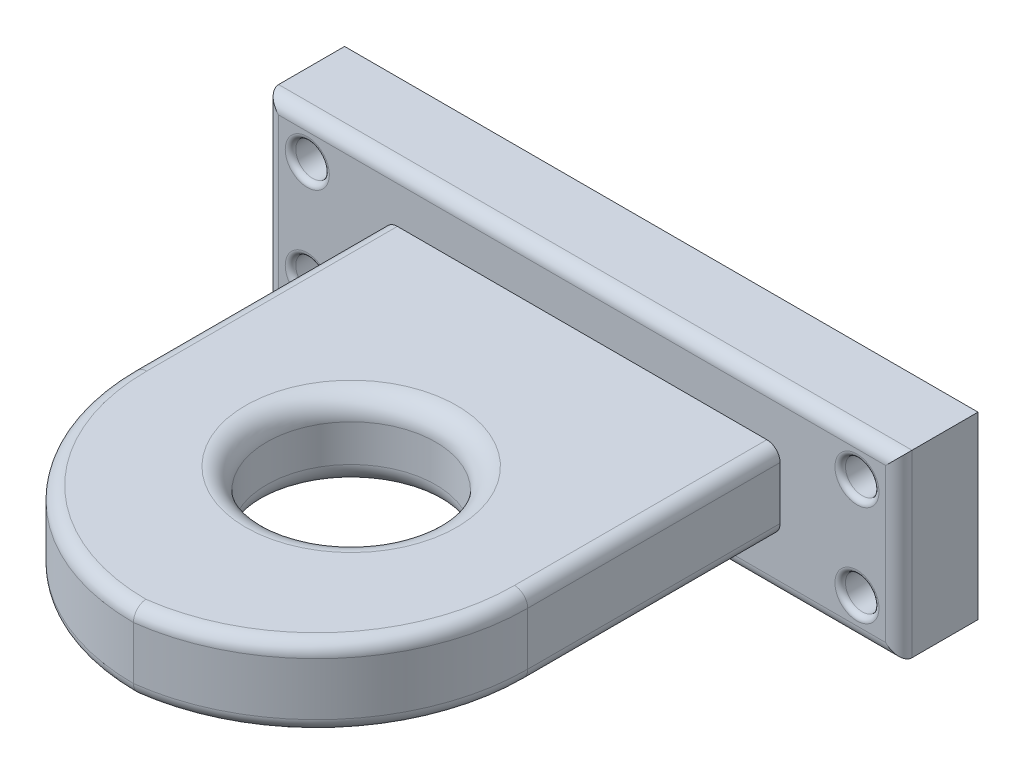
from build123d import *

# Parameters (mm, degrees)
SKETCH1_W           = 150
SKETCH1_H           = 175
BOSS_EXTRUDE1_DEPTH = 30
SKETCH3_R           = 32
CUT_EXTRUDE2_DEPTH  = 233.432785983
FILLET1_R           = 80
FILLET2_R           = 80
FILLET3_R           = 8
FILLET4_R           = 8
SKETCH5_W           = 240
SKETCH5_H           = 68.1
BOSS_EXTRUDE5_DEPTH = 30
FILLET5_R           = 5
FILLET6_R           = 5
SKETCH7_R           = 6.35
CUT_EXTRUDE3_DEPTH  = 267.563130487
FILLET7_R           = 2


with BuildPart() as part:
    # Sketch1 → Boss-Extrude1 (new body)
    with BuildSketch(Plane(origin=(0, 0, 0), x_dir=(1, 0, 0), z_dir=(0, 1, 0))):
        with Locations((75, -87.5)):
            Rectangle(SKETCH1_W, SKETCH1_H)
    extrude(amount=BOSS_EXTRUDE1_DEPTH)

    # Sketch3 → Cut-Extrude2 (cut, through all)
    with BuildSketch(Plane(origin=(0, 30, 0), x_dir=(-1, 0, 0), z_dir=(0, 1, 0))):
        with Locations(Location((-75, 87.5, 0), (0, 0, 90))):
            Circle(SKETCH3_R)
    extrude(amount=-CUT_EXTRUDE2_DEPTH, mode=Mode.SUBTRACT)

    # Fillet1
    fillet1_edges = [part.edges().sort_by_distance(p)[0] for p in [
        (0, 15, 175),
    ]]
    fillet(fillet1_edges, radius=FILLET1_R)

    # Fillet2
    # the kernel refuses this fillet: 80 mm, written as the material it takes off along each edge
    with BuildSketch(Plane(origin=(150, -198.43134833, 175), x_dir=(-1, 0, 0), z_dir=(0, 1, 0))) as fillet2_piece_1:
        with BuildLine():
            CenterArc((80, -79.372539332), FILLET2_R, 97.180755781, 82.819244219)
            Line((0, -79.372539332), (-1.6, -79.372539332))
            Line((-1.6, -79.372539332), (-1.6, 0))
            Line((-1.6, 0), (0, 1.6))
            ThreePointArc((0, 1.6), (35, 1.6), (69.8, 1.587450787))
            Line((69.8, 1.587450787), (70, 0))
        make_face()
    extrude(amount=426.86269666, mode=Mode.SUBTRACT)

    # Fillet3
    fillet3_edges = [part.edges().sort_by_distance(p)[0] for p in [
        (75, 30, 55.5),
    ]]
    fillet(fillet3_edges, radius=FILLET3_R)

    # Fillet4
    fillet4_edges = [part.edges().sort_by_distance(p)[0] for p in [
        (75, 0, 55.5),
    ]]
    fillet(fillet4_edges, radius=FILLET4_R)

    # Sketch5 → Boss-Extrude5 (add)
    with BuildSketch(Plane(origin=(0, 0, 0), x_dir=(-1, 0, 0), z_dir=(0, 0, -1))):
        with Locations((-75, 15)):
            Rectangle(SKETCH5_W, SKETCH5_H)
    extrude(amount=BOSS_EXTRUDE5_DEPTH)

    # Fillet5
    fillet5_edges = [part.edges().sort_by_distance(p)[0] for p in [
        (195, 15, 0),
        (75, -19.05, 0),
        (-45, 15, 0),
        (75, 49.05, 0),
    ]]
    fillet(fillet5_edges, radius=FILLET5_R)

    # Fillet6
    # the kernel refuses this fillet: 5 mm, written as the material it takes off along each edge
    with BuildSketch(Plane(origin=(80, 0, 95), x_dir=(-1, 0, 0), z_dir=(0, 0, -1))) as fillet6_piece_1:
        with BuildLine():
            CenterArc((80 - FILLET6_R, FILLET6_R), FILLET6_R, 270, 90)
            Line((80, FILLET6_R), (80, 0))
            Line((80, 0), (80 - FILLET6_R, 0))
        make_face()
    revolve(axis=Axis((80, 0, 95), (0, 1, 0)), revolution_arc=134.780309137, mode=Mode.SUBTRACT)
    with BuildSketch(Plane(origin=(80, 30, 95), x_dir=(-1, 0, 0), z_dir=(0, 0, -1))) as fillet6_piece_2:
        with BuildLine():
            CenterArc((80 - FILLET6_R, -FILLET6_R), FILLET6_R, 0, 90)
            Line((80, -FILLET6_R), (80, 0))
            Line((80, 0), (80 - FILLET6_R, 0))
        make_face()
    revolve(axis=Axis((80, 30, 95), (0, 1, 0)), revolution_arc=134.780309137, mode=Mode.SUBTRACT)
    with BuildSketch(Plane(origin=(150, 0, 0), x_dir=(-1, 0, 0), z_dir=(0, 0, 1)), Plane(origin=(150, 30, 0), x_dir=(0, -1, 0), z_dir=(0, 0, 1))) as fillet6_piece_3:
        with BuildLine():
            CenterArc((FILLET6_R, -FILLET6_R), FILLET6_R, 90, 90)
            Line((0, -FILLET6_R), (0, 0))
            Line((0, 0), (FILLET6_R, 0))
        make_face()
    extrude(amount=95.627460668, mode=Mode.SUBTRACT)
    with BuildSketch(Plane(origin=(70, 0, 95.627460668), x_dir=(1, 0, 0), z_dir=(0, 0, -1))) as fillet6_piece_4:
        with BuildLine():
            CenterArc((80 - FILLET6_R, -FILLET6_R), FILLET6_R, 0, 90)
            Line((80, -FILLET6_R), (80, 0))
            Line((80, 0), (80 - FILLET6_R, 0))
        make_face()
    revolve(axis=Axis((70, 0, 95.627460668), (0, -1, 0)), revolution_arc=127.596797833, mode=Mode.SUBTRACT)
    with BuildSketch(Plane(origin=(70, 30, 95.627460668), x_dir=(1, 0, 0), z_dir=(0, 0, -1))) as fillet6_piece_5:
        with BuildLine():
            CenterArc((80 - FILLET6_R, FILLET6_R), FILLET6_R, 270, 90)
            Line((80, FILLET6_R), (80, 0))
            Line((80, 0), (80 - FILLET6_R, 0))
        make_face()
    revolve(axis=Axis((70, 30, 95.627460668), (0, -1, 0)), revolution_arc=127.596797833, mode=Mode.SUBTRACT)
    with BuildSketch(Plane(origin=(0, 30, 95), x_dir=(1, 0, 0), z_dir=(0, 0, -1))) as fillet6_piece_6:
        with BuildLine():
            CenterArc((FILLET6_R, FILLET6_R), FILLET6_R, 180, 90)
            Line((0, FILLET6_R), (0, 0))
            Line((0, 0), (FILLET6_R, 0))
        make_face()
    extrude(amount=95, mode=Mode.SUBTRACT)
    with BuildSketch(Plane(origin=(0, 0, 95), x_dir=(1, 0, 0), z_dir=(0, 0, -1))) as fillet6_piece_7:
        with BuildLine():
            CenterArc((FILLET6_R, -FILLET6_R), FILLET6_R, 90, 90)
            Line((0, -FILLET6_R), (0, 0))
            Line((0, 0), (FILLET6_R, 0))
        make_face()
    extrude(amount=95, mode=Mode.SUBTRACT)

    # Sketch7 → Cut-Extrude3 (cut, through all)
    with BuildSketch(Plane.XY):
        with Locations((179.14, 34.05)):
            Circle(SKETCH7_R)
        with Locations(Location((179.14, -4.05, 0), (0, 0, 180))):
            Circle(SKETCH7_R)
        with Locations(Location((-29.14, 34.05, 0), (0, 0, 180))):
            Circle(SKETCH7_R)
        with Locations((-29.14, -4.05)):
            Circle(SKETCH7_R)
    extrude(amount=-CUT_EXTRUDE3_DEPTH, mode=Mode.SUBTRACT)

    # Fillet7
    fillet7_edges = [part.edges().sort_by_distance(p)[0] for p in [
        (-22.79, 34.05, 0),
        (-35.49, -4.05, 0),
        (172.79, 34.05, 0),
        (185.49, -4.05, 0),
    ]]
    fillet(fillet7_edges, radius=FILLET7_R)


solid = part.part
